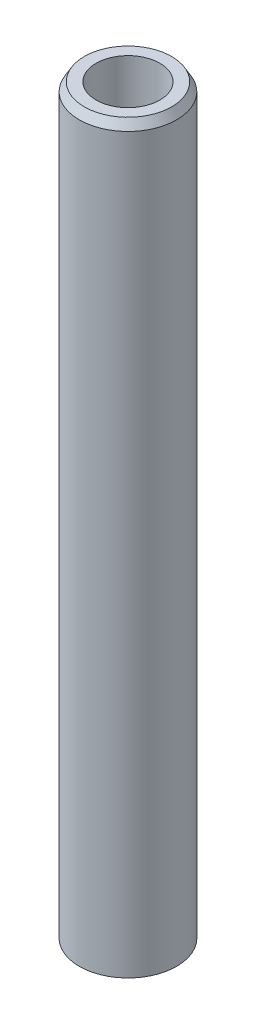
from build123d import *
from OCP.BRepFilletAPI import BRepFilletAPI_MakeChamfer

# Parameters (mm, degrees)
SKETCH1_R           = 20
BOSS_EXTRUDE1_DEPTH = 306.705013331
SKETCH2_R           = 13.10402825
CUT_EXTRUDE1_DEPTH  = 309.006436949
CHAMFER1_SIZE       = 3.586078885
CHAMFER1_SIZE2      = 2.070423609


with BuildPart() as part:
    # Sketch1 → Boss-Extrude1 (new body)
    with BuildSketch(Plane(origin=(0, 0, 0), x_dir=(1, 0, 0), z_dir=(0, 1, 0))):
        Circle(SKETCH1_R)
    extrude(amount=BOSS_EXTRUDE1_DEPTH)

    # Sketch2 → Cut-Extrude1 (cut, through all)
    with BuildSketch(Plane(origin=(0, 0, 0), x_dir=(1, 0, 0), z_dir=(0, 1, 0))):
        Circle(SKETCH2_R)
    extrude(amount=CUT_EXTRUDE1_DEPTH, mode=Mode.SUBTRACT)

    # Chamfer1: one chamfer whose edges measure the first distance from different faces: ONE call of the kernel's chamfer builder (chamfer() names one face for all edges)
    chamfer1_edges_1 = [part.edges().sort_by_distance(p)[0] for p in [
        (-20, 306.705013331, 0),
    ]]
    chamfer1_side_1 = [part.faces().sort_by_distance(p)[0] for p in [
        (-20, 153.352506665, 0),
    ]]
    chamfer1_edges_2 = [part.edges().sort_by_distance(p)[0] for p in [
        (-20, 0, 0),
    ]]
    chamfer1_side_2 = [part.faces().sort_by_distance(p)[0] for p in [
        (-19.434314575, 0, 0),
    ]]
    chamfer1 = BRepFilletAPI_MakeChamfer(part.part.solid().wrapped)
    for e in chamfer1_edges_1:
        chamfer1.Add(CHAMFER1_SIZE, CHAMFER1_SIZE2, e.wrapped, chamfer1_side_1[0].wrapped)  # the first distance lies on this face
    for e in chamfer1_edges_2:
        chamfer1.Add(CHAMFER1_SIZE, CHAMFER1_SIZE2, e.wrapped, chamfer1_side_2[0].wrapped)  # the first distance lies on this face
    add(Compound.cast(chamfer1.Shape()), mode=Mode.REPLACE)


solid = part.part
